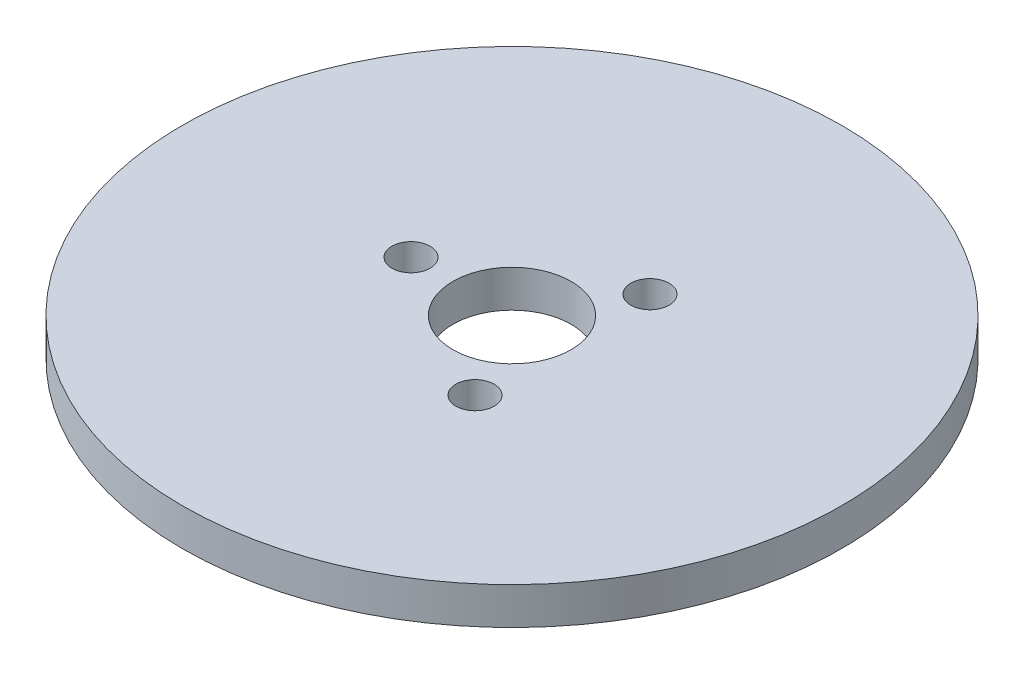
from build123d import *

# Parameters (mm, degrees)
SKETCH1_R           = 97.5
BOSS_EXTRUDE1_DEPTH = 11
SKETCH2_R           = 17.5
CUT_EXTRUDE1_DEPTH  = 139.32389526
SKETCH3_R           = 5.655844815
CUT_EXTRUDE2_DEPTH  = 10.165892716
CIRPATTERN1_COUNT   = 3


with BuildPart() as part:
    # Sketch1 → Boss-Extrude1 (new body)
    with BuildSketch(Plane(origin=(0, 0, 0), x_dir=(1, 0, 0), z_dir=(0, 1, 0))):
        Circle(SKETCH1_R)
    extrude(amount=BOSS_EXTRUDE1_DEPTH)

    # Sketch2 → Cut-Extrude1 (cut, through all)
    with BuildSketch(Plane(origin=(0, 0, 0), x_dir=(1, 0, 0), z_dir=(0, 1, 0))):
        Circle(SKETCH2_R)
    extrude(amount=CUT_EXTRUDE1_DEPTH, mode=Mode.SUBTRACT)

    # Sketch3 → Cut-Extrude2 (cut)
    with BuildSketch(Plane(origin=(0, 11, 0), x_dir=(1, 0, 0), z_dir=(0, 1, 0))):
        with Locations((-29.876632649, 0)):
            Circle(SKETCH3_R)
    cut_extrude2 = extrude(amount=-CUT_EXTRUDE2_DEPTH, mode=Mode.SUBTRACT)

    # CirPattern1: Cut-Extrude2 ×3 about axis
    cirpattern1_axis = Axis((0, 0, 0), (0, 1, 0))
    for i in range(1, CIRPATTERN1_COUNT):
        add(cut_extrude2.rotate(cirpattern1_axis, i * 360 / CIRPATTERN1_COUNT), mode=Mode.SUBTRACT)


solid = part.part
